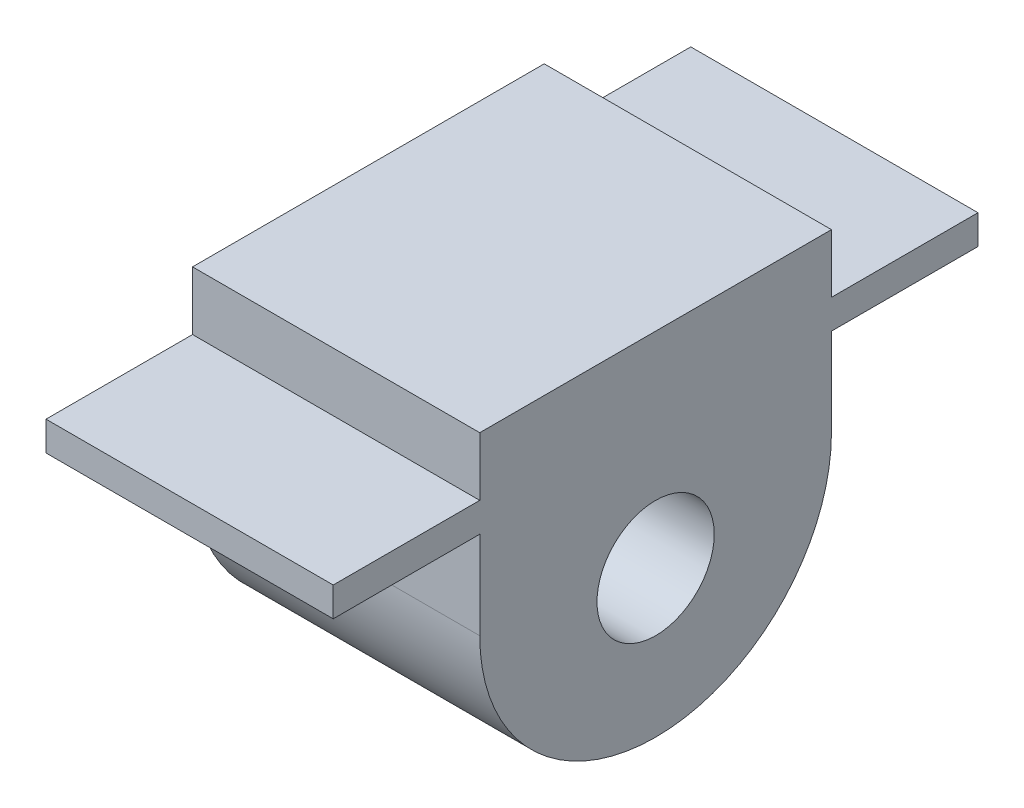
from build123d import *

# Parameters (mm, degrees)
SKETCH1_W                    = 99
SKETCH1_H                    = 25
SKETCH1_W_2                  = 93
SKETCH1_H_2                  = 19
BOSS_EXTRUDE1_DEPTH          = 10
SKETCH2_R                    = 40
CUT_EXTRUDE1_DEPTH           = 8
SKETCH5_W                    = 10
SKETCH5_H                    = 25
BOSS_EXTRUDE5_DEPTH          = 2
SKETCH6_W                    = 6
SKETCH6_H                    = 19
BOSS_EXTRUDE6_DEPTH          = 2
SKETCH7_W                    = 8
SKETCH7_H                    = 3
BOSS_EXTRUDE7_DEPTH          = 30
FILLET5_R                    = 3
FILLET7_R                    = 5
FILLET8_R                    = 20
FILLET9_R                    = 1.5
FILLET10_R                   = 6
FILLET11_R                   = 3
SKETCH8_W                    = 20
SKETCH8_H                    = 25
BOSS_EXTRUDE8_DEPTH          = 2
SKETCH9_W                    = 9.8
SKETCH9_H                    = 12
BOSS_EXTRUDE9_DEPTH          = 10
SKETCH10_R                   = 2
CUT_EXTRUDE2_DEPTH           = 23
FILLET12_R                   = 6
CUT_EXTRUDE_THIN1_DEPTH      = 65.857536204
CUT_EXTRUDE_THIN1_DEPTH_BACK = 65.857536204
SKETCH11_W                   = 109.8
SKETCH11_H                   = 112
SKETCH11_W_2                 = 9.8
SKETCH11_H_2                 = 12
SKETCH12_W                   = 9.8
SKETCH12_H                   = 1
BOSS_EXTRUDE10_DEPTH         = 5


with BuildPart() as part:
    # Sketch1 → Boss-Extrude1 (new body)
    with BuildSketch(Plane(origin=(0, 0, 0), x_dir=(1, 0, 0), z_dir=(0, 1, 0))):
        Rectangle(SKETCH1_W, SKETCH1_H)
        Rectangle(SKETCH1_W_2, SKETCH1_H_2, mode=Mode.SUBTRACT)
    extrude(amount=BOSS_EXTRUDE1_DEPTH)

    # Sketch2 → Cut-Extrude1 (cut)
    with BuildSketch(Plane.XY.offset(12.5)):
        with Locations((21.780912994, 42.853113242)):
            Circle(SKETCH2_R)
    extrude(amount=-CUT_EXTRUDE1_DEPTH, mode=Mode.SUBTRACT)

    # Sketch5 → Boss-Extrude5 (add)
    with BuildSketch(Plane.XZ):
        with Locations((-29.5, 0)):
            Rectangle(SKETCH5_W, SKETCH5_H)
    extrude(amount=-BOSS_EXTRUDE5_DEPTH)

    # Sketch6 → Boss-Extrude6 (add)
    with BuildSketch(Plane.XZ):
        with Locations((43.5, 0)):
            Rectangle(SKETCH6_W, SKETCH6_H)
    extrude(amount=-BOSS_EXTRUDE6_DEPTH)

    # Sketch7 → Boss-Extrude7 (add)
    with BuildSketch(Plane(origin=(0, 10, 0), x_dir=(1, 0, 0), z_dir=(0, 1, 0))):
        with Locations((-32.5, -11)):
            Rectangle(SKETCH7_W, SKETCH7_H)
    extrude(amount=BOSS_EXTRUDE7_DEPTH)

    # Fillet5
    fillet5_edges = [part.edges().sort_by_distance(p)[0] for p in [
        (-34.5, 1, 9.5),
        (-24.5, 1, 9.5),
        (-24.5, 1, -9.5),
        (-34.5, 1, -9.5),
        (40.5, 1, -9.5),
        (40.5, 1, 9.5),
    ]]
    fillet(fillet5_edges, radius=FILLET5_R)

    # Fillet7
    fillet7_edges = [part.edges().sort_by_distance(p)[0] for p in [
        (44.599172136, 10, 11),
    ]]
    fillet(fillet7_edges, radius=FILLET7_R)

    # Fillet8
    fillet8_edges = [part.edges().sort_by_distance(p)[0] for p in [
        (-1.037346149, 10, 11),
    ]]
    fillet(fillet8_edges, radius=FILLET8_R)

    # Fillet9
    fillet9_edges = [part.edges().sort_by_distance(p)[0] for p in [
        (46.5, 6, 9.5),
        (46.5, 6, -9.5),
        (-46.5, 5, -9.5),
        (-46.5, 5, 9.5),
        (-49.5, 5, 12.5),
        (-49.5, 5, -12.5),
        (49.5, 5, -12.5),
        (49.5, 5, 12.5),
    ]]
    fillet(fillet9_edges, radius=FILLET9_R)

    # Fillet10
    fillet10_edges = [part.edges().sort_by_distance(p)[0] for p in [
        (-36.5, 10, 11),
        (-28.5, 10, 11),
    ]]
    fillet(fillet10_edges, radius=FILLET10_R)

    # Fillet11
    fillet11_edges = [part.edges().sort_by_distance(p)[0] for p in [
        (-36.5, 40, 11),
        (-28.5, 40, 11),
    ]]
    fillet(fillet11_edges, radius=FILLET11_R)

    # Sketch8 → Boss-Extrude8 (add)
    with BuildSketch(Plane.XZ):
        Rectangle(SKETCH8_W, SKETCH8_H)
    extrude(amount=-BOSS_EXTRUDE8_DEPTH)

    # Sketch9 → Boss-Extrude9 (add)
    with BuildSketch(Plane.XZ):
        Rectangle(SKETCH9_W, SKETCH9_H)
    extrude(amount=BOSS_EXTRUDE9_DEPTH)

    # Sketch10 → Cut-Extrude2 (cut)
    with BuildSketch(Plane(origin=(4.9, 0, 0), x_dir=(0, 0, -1), z_dir=(1, 0, 0))):
        with Locations((0, -5)):
            Circle(SKETCH10_R)
    extrude(amount=-CUT_EXTRUDE2_DEPTH, mode=Mode.SUBTRACT)

    # Fillet12
    fillet12_edges = [part.edges().sort_by_distance(p)[0] for p in [
        (0, -10, 6),
        (0, -10, -6),
    ]]
    fillet(fillet12_edges, radius=FILLET12_R - 0.0001)  # a hair under: the kernel refuses the full size

    # Sketch11 → Cut-Extrude-Thin1 (cut, two sides: drawn at the far end of the back side and taken through both)
    with BuildSketch(Plane.XZ.offset(-CUT_EXTRUDE_THIN1_DEPTH_BACK)):
        Rectangle(SKETCH11_W, SKETCH11_H)
        Rectangle(SKETCH11_W_2, SKETCH11_H_2, mode=Mode.SUBTRACT)
    extrude(amount=CUT_EXTRUDE_THIN1_DEPTH + CUT_EXTRUDE_THIN1_DEPTH_BACK, mode=Mode.SUBTRACT)

    # Sketch12 → Boss-Extrude10 (add)
    with BuildSketch(Plane(origin=(0, 0, -6), x_dir=(-1, 0, 0), z_dir=(0, 0, -1))):
        with Locations((0, -0.5)):
            Rectangle(SKETCH12_W, SKETCH12_H)
    boss_extrude10 = extrude(amount=BOSS_EXTRUDE10_DEPTH)

    # Mirror1: Boss-Extrude10 across plane
    add(boss_extrude10.mirror(Plane.XY))


solid = part.part
